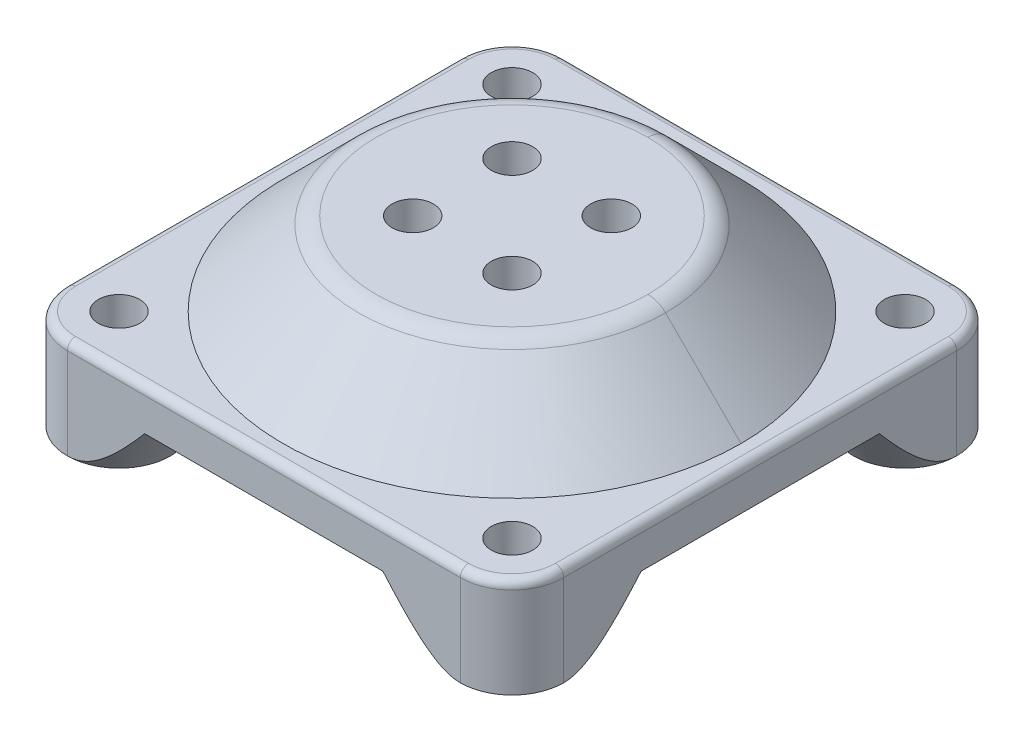
from build123d import *
from build123d.topology import SkipClean

# Parameters (mm, degrees)
SKETCH_1_W          = 60
SKETCH_1_H          = 60
EXTRUDE_1_DEPTH     = 5
EXTRUDE_START       = 5
SKETCH_2_R          = 17.67766953
EXTRUDE_3_DEPTH     = 10
SKETCH_6_W          = 30
SKETCH_6_H          = 30
CUT_EXTRUDE_2_DEPTH = 5
CHAMFER_1_SIZE      = 5
SKETCH_7_R          = 6.25
EXTRUDE_4_DEPTH     = 7
CUT_EXTRUDE_START   = 5
CUT_EXTRUDE_3_DEPTH = 5
CUT_EXTRUDE_4_DEPTH = 7
SKETCH_18_R         = 2.5
CUT_EXTRUDE_5_DEPTH = 12
SKETCH_21_R         = 2.5
CUT_EXTRUDE_6_DEPTH = 10
FILLET_1_R          = 1
FILLET_2_R          = 3


with BuildPart() as part:
    # 草图1 → 凸台-拉伸1 (new body)
    with BuildSketch(Plane(origin=(0, 0, 0), x_dir=(1, 0, 0), z_dir=(0, 1, 0))):
        Rectangle(SKETCH_1_W, SKETCH_1_H)
    extrude(amount=EXTRUDE_1_DEPTH)

    # 草图2 → 凸台-拉伸3 (add)
    with BuildSketch(Plane(origin=(0, 0, 0), x_dir=(1, 0, 0), z_dir=(0, 1, 0)).offset(EXTRUDE_START)):
        with Locations(Location((0, 0, 0), (0, 0, 90))):
            Circle(SKETCH_2_R)
    extrude(amount=EXTRUDE_3_DEPTH)

    # 扫描1: sweep along a curve in space
    with BuildLine() as sweep_1_path:
        ThreePointArc((0, 5, -17.67766953), (12.5, 5, -12.5), (17.67766953, 5, 0))
        ThreePointArc((17.67766953, 5, 0), (12.5, 5, 12.5), (0, 5, 17.67766953))
        ThreePointArc((0, 5, 17.67766953), (-12.5, 5, 12.5), (-17.67766953, 5, 0))
        ThreePointArc((-17.67766953, 5, 0), (-12.5, 5, -12.5), (0, 5, -17.67766953))
    # 草图4 → 扫描1 (sweep)
    with BuildSketch(Plane.XY):
        Polygon((17.67766953, 15), (17.67766953, 5), (27.67766953, 5), align=None)
    sweep(path=sweep_1_path.line)

    # 草图6 → 切除-拉伸2 (cut)
    with BuildSketch(Plane(origin=(0, 0, 0), x_dir=(1, 0, 0), z_dir=(0, 1, 0))):
        Rectangle(SKETCH_6_W, SKETCH_6_H)
    extrude(amount=CUT_EXTRUDE_2_DEPTH, mode=Mode.SUBTRACT)

    # 倒角1
    chamfer_1_edges = [part.edges().sort_by_distance(p)[0] for p in [
        (0, 5, -15),
        (-15, 5, 0),
        (0, 5, 15),
        (15, 5, 0),
    ]]
    chamfer(chamfer_1_edges, length=CHAMFER_1_SIZE - 0.0001)  # a hair under: the kernel refuses the full size

    # 草图7 → 凸台-拉伸4 (add)
    with BuildSketch(Plane(origin=(0, 0, 0), x_dir=(1, 0, 0), z_dir=(0, 1, 0))):
        with Locations(Location((-23.75, 23.75, 0), (0, 0, 270))):
            Circle(SKETCH_7_R)
        with Locations(Location((23.75, 23.75, 0), (0, 0, 270))):
            Circle(SKETCH_7_R)
        with Locations(Location((-23.75, -23.75, 0), (0, 0, 270))):
            Circle(SKETCH_7_R)
        with Locations(Location((23.75, -23.75, 0), (0, 0, 270))):
            Circle(SKETCH_7_R)
    extrude(amount=-EXTRUDE_4_DEPTH)

    # 草图8 → 切除-拉伸3 (cut)
    with BuildSketch(Plane(origin=(0, 0, 0), x_dir=(1, 0, 0), z_dir=(0, 1, 0)).offset(CUT_EXTRUDE_START)):
        with BuildLine():
            Line((23.75, 30), (30, 30))
            Line((30, 30), (30, 23.75))
            ThreePointArc((30, 23.75), (28.169417382, 28.169417382), (23.75, 30))
        make_face()
        with BuildLine():
            Line((-30, 30), (-23.75, 30))
            ThreePointArc((-23.75, 30), (-28.169417382, 28.169417382), (-30, 23.75))
            Line((-30, 23.75), (-30, 30))
        make_face()
        with BuildLine():
            Line((-23.75, -30), (-30, -30))
            Line((-30, -30), (-30, -23.75))
            ThreePointArc((-30, -23.75), (-28.169417382, -28.169417382), (-23.75, -30))
        make_face()
        with BuildLine():
            Line((30, -23.75), (30, -30))
            Line((30, -30), (23.75, -30))
            ThreePointArc((23.75, -30), (28.169417382, -28.169417382), (30, -23.75))
        make_face()
    extrude(amount=-CUT_EXTRUDE_3_DEPTH, mode=Mode.SUBTRACT)

    # 草图9 → 旋转1 (revolve)
    with BuildSketch(Plane(origin=(0, 0, 23.75), x_dir=(-1, 0, 0), z_dir=(0, 0, -1)), mode=Mode.PRIVATE) as revolve_1_sk:
        Polygon((17.5, -7), (17.5, 0), (12.5, 0), align=None)
    revolve(revolve_1_sk.sketch.rotate(Axis((-23.75, 5, 23.75), (0, -1, 0)), 90), axis=Axis((-23.75, 5, 23.75), (0, -1, 0)))

    # 草图13 → 旋转2 (revolve)
    with BuildSketch(Plane(origin=(0, 0, 23.75), x_dir=(-1, 0, 0), z_dir=(0, 0, -1)), mode=Mode.PRIVATE) as revolve_2_sk:
        Polygon((-17.5, 0), (-17.5, -7), (-12.5, 0), align=None)
    revolve(revolve_2_sk.sketch.rotate(Axis((23.75, 5, 23.75), (0, -1, 0)), 270), axis=Axis((23.75, 5, 23.75), (0, -1, 0)))

    # 草图14 → 旋转3 (revolve)
    with BuildSketch(Plane(origin=(0, 0, -23.75), x_dir=(-1, 0, 0), z_dir=(0, 0, -1)), mode=Mode.PRIVATE) as revolve_3_sk:
        Polygon((-17.5, -7), (-12.5, 0), (-17.5, 0), align=None)
    revolve(revolve_3_sk.sketch.rotate(Axis((23.75, 5, -23.75), (0, -1, 0)), 270), axis=Axis((23.75, 5, -23.75), (0, -1, 0)))

    # 草图16 → 旋转4 (revolve)
    with BuildSketch(Plane(origin=(0, 0, -23.75), x_dir=(-1, 0, 0), z_dir=(0, 0, -1)), mode=Mode.PRIVATE) as revolve_4_sk:
        Polygon((17.5, 0), (17.5, -7), (12.5, 0), align=None)
    revolve(revolve_4_sk.sketch.rotate(Axis((-23.75, 5, -23.75), (0, -1, 0)), 90), axis=Axis((-23.75, 5, -23.75), (0, -1, 0)))

    # 草图17 → 切除-拉伸4 (cut)
    with SkipClean():  # the faces are left unmerged after this step: merging them gives an invalid solid
        with BuildSketch(Plane(origin=(0, 0, 0), x_dir=(1, 0, 0), z_dir=(0, 1, 0))):
            with BuildLine():
                Line((-30, -23.75), (-30, -14.395856533))
                ThreePointArc((-30, -14.395856533), (-31.704951288, -31.704951288), (-14.395856533, -30))
                Line((-14.395856533, -30), (-23.75, -30))
                ThreePointArc((-23.75, -30), (-28.169417382, -28.169417382), (-30, -23.75))
            make_face()
            with BuildLine():
                Line((30, -14.395856533), (30, -23.75))
                ThreePointArc((30, -23.75), (28.169417382, -28.169417382), (23.75, -30))
                Line((23.75, -30), (14.395856533, -30))
                ThreePointArc((14.395856533, -30), (31.704951288, -31.704951288), (30, -14.395856533))
            make_face()
            with BuildLine():
                Line((30, 23.75), (30, 14.395856533))
                ThreePointArc((30, 14.395856533), (31.704951288, 31.704951288), (14.395856533, 30))
                Line((14.395856533, 30), (23.75, 30))
                ThreePointArc((23.75, 30), (28.169417382, 28.169417382), (30, 23.75))
            make_face()
            with BuildLine():
                Line((-23.75, 30), (-14.395856533, 30))
                ThreePointArc((-14.395856533, 30), (-31.704951288, 31.704951288), (-30, 14.395856533))
                Line((-30, 14.395856533), (-30, 23.75))
                ThreePointArc((-30, 23.75), (-28.169417382, 28.169417382), (-23.75, 30))
            make_face()
        extrude(amount=-CUT_EXTRUDE_4_DEPTH, mode=Mode.SUBTRACT)

    # 草图18 → 切除-拉伸5 (cut)
    with SkipClean():  # the faces are left unmerged after this step: merging them gives an invalid solid
        with BuildSketch(Plane(origin=(0, 0, 0), x_dir=(1, 0, 0), z_dir=(0, 1, 0)).offset(CUT_EXTRUDE_START)):
            with Locations(Location((-23.75, 23.75, 0), (0, 0, 270))):
                Circle(SKETCH_18_R)
            with Locations(Location((23.75, 23.75, 0), (0, 0, 270))):
                Circle(SKETCH_18_R)
            with Locations(Location((-23.75, -23.75, 0), (0, 0, 270))):
                Circle(SKETCH_18_R)
            with Locations(Location((23.75, -23.75, 0), (0, 0, 270))):
                Circle(SKETCH_18_R)
        extrude(amount=-CUT_EXTRUDE_5_DEPTH, mode=Mode.SUBTRACT)

    # 草图21 → 切除-拉伸6 (cut)
    with SkipClean():  # the faces are left unmerged after this step: merging them gives an invalid solid
        with BuildSketch(Plane(origin=(0, 0, 0), x_dir=(1, 0, 0), z_dir=(0, 1, 0)).offset(CUT_EXTRUDE_START)):
            with Locations(Location((-6, 6, 0), (0, 0, 90))):
                Circle(SKETCH_21_R)
            with Locations(Location((6, 6, 0), (0, 0, 90))):
                Circle(SKETCH_21_R)
            with Locations(Location((6, -6, 0), (0, 0, 90))):
                Circle(SKETCH_21_R)
            with Locations(Location((-6, -6, 0), (0, 0, 90))):
                Circle(SKETCH_21_R)
        extrude(amount=CUT_EXTRUDE_6_DEPTH, mode=Mode.SUBTRACT)

    # 圆角1
    fillet_1_edges = [part.edges().sort_by_distance(p)[0] for p in [
        (0, 5, 30),
        (-30, 5, 0),
        (0, 5, -30),
        (30, 5, 0),
        (28.169417382, 5, 28.169417382),
        (-28.169417382, 5, 28.169417382),
        (-28.169417382, 5, -28.169417382),
        (28.169417382, 5, -28.169417382),
    ]]
    fillet(fillet_1_edges, radius=FILLET_1_R)

    # 圆角2
    fillet_2_edges = [part.edges().sort_by_distance(p)[0] for p in [
        (0, 15, -17.67766953),
        (-12.5, 15, 12.5),
    ]]
    fillet(fillet_2_edges, radius=FILLET_2_R)


solid = part.part
